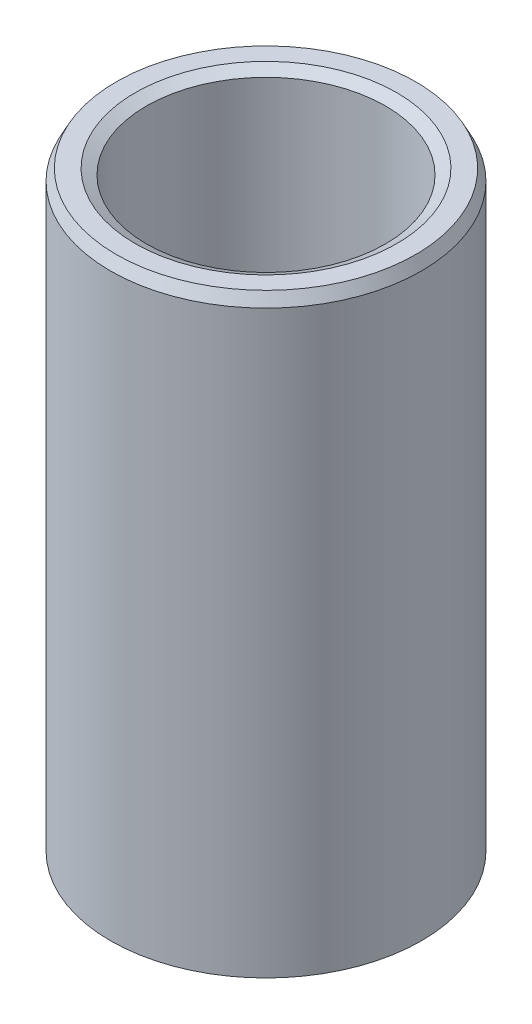
from build123d import *
from OCP.BRepFilletAPI import BRepFilletAPI_MakeChamfer

# Parameters (mm, degrees)
SKETCH1_R           = 25
BOSS_EXTRUDE1_DEPTH = 95.986730982
SKETCH2_R           = 19.212010579
CUT_EXTRUDE1_DEPTH  = 103.291018787
CHAMFER1_SIZE       = 1.809203165
CHAMFER1_SIZE2      = 0.942688678


with BuildPart() as part:
    # Sketch1 → Boss-Extrude1 (new body)
    with BuildSketch(Plane(origin=(0, 0, 0), x_dir=(1, 0, 0), z_dir=(0, 1, 0))):
        Circle(SKETCH1_R)
    extrude(amount=BOSS_EXTRUDE1_DEPTH)

    # Sketch2 → Cut-Extrude1 (cut, through all)
    with BuildSketch(Plane(origin=(0, 0, 0), x_dir=(1, 0, 0), z_dir=(0, 1, 0))):
        Circle(SKETCH2_R)
    extrude(amount=CUT_EXTRUDE1_DEPTH, mode=Mode.SUBTRACT)

    # Chamfer1: one chamfer whose edges measure the first distance from different faces: ONE call of the kernel's chamfer builder (chamfer() names one face for all edges)
    chamfer1_edges_1 = [part.edges().sort_by_distance(p)[0] for p in [
        (-19.212010579, 95.986730982, 0),
    ]]
    chamfer1_side_1 = [part.faces().sort_by_distance(p)[0] for p in [
        (-24.292893219, 95.986730982, 0),
    ]]
    chamfer1_edges_2 = [part.edges().sort_by_distance(p)[0] for p in [
        (-19.212010579, 0, 0),
    ]]
    chamfer1_side_2 = [part.faces().sort_by_distance(p)[0] for p in [
        (-19.212010579, 47.993365491, 0),
    ]]
    chamfer1_edges_3 = [part.edges().sort_by_distance(p)[0] for p in [
        (-25, 0, 0),
    ]]
    chamfer1_side_3 = [part.faces().sort_by_distance(p)[0] for p in [
        (-24.292893219, 0, 0),
    ]]
    chamfer1_edges_4 = [part.edges().sort_by_distance(p)[0] for p in [
        (-25, 95.986730982, 0),
    ]]
    chamfer1_side_4 = [part.faces().sort_by_distance(p)[0] for p in [
        (-25, 47.993365491, 0),
    ]]
    chamfer1 = BRepFilletAPI_MakeChamfer(part.part.solid().wrapped)
    for e in chamfer1_edges_1:
        chamfer1.Add(CHAMFER1_SIZE, CHAMFER1_SIZE2, e.wrapped, chamfer1_side_1[0].wrapped)  # the first distance lies on this face
    for e in chamfer1_edges_2:
        chamfer1.Add(CHAMFER1_SIZE, CHAMFER1_SIZE2, e.wrapped, chamfer1_side_2[0].wrapped)  # the first distance lies on this face
    for e in chamfer1_edges_3:
        chamfer1.Add(CHAMFER1_SIZE, CHAMFER1_SIZE2, e.wrapped, chamfer1_side_3[0].wrapped)  # the first distance lies on this face
    for e in chamfer1_edges_4:
        chamfer1.Add(CHAMFER1_SIZE, CHAMFER1_SIZE2, e.wrapped, chamfer1_side_4[0].wrapped)  # the first distance lies on this face
    add(Compound.cast(chamfer1.Shape()), mode=Mode.REPLACE)


solid = part.part
